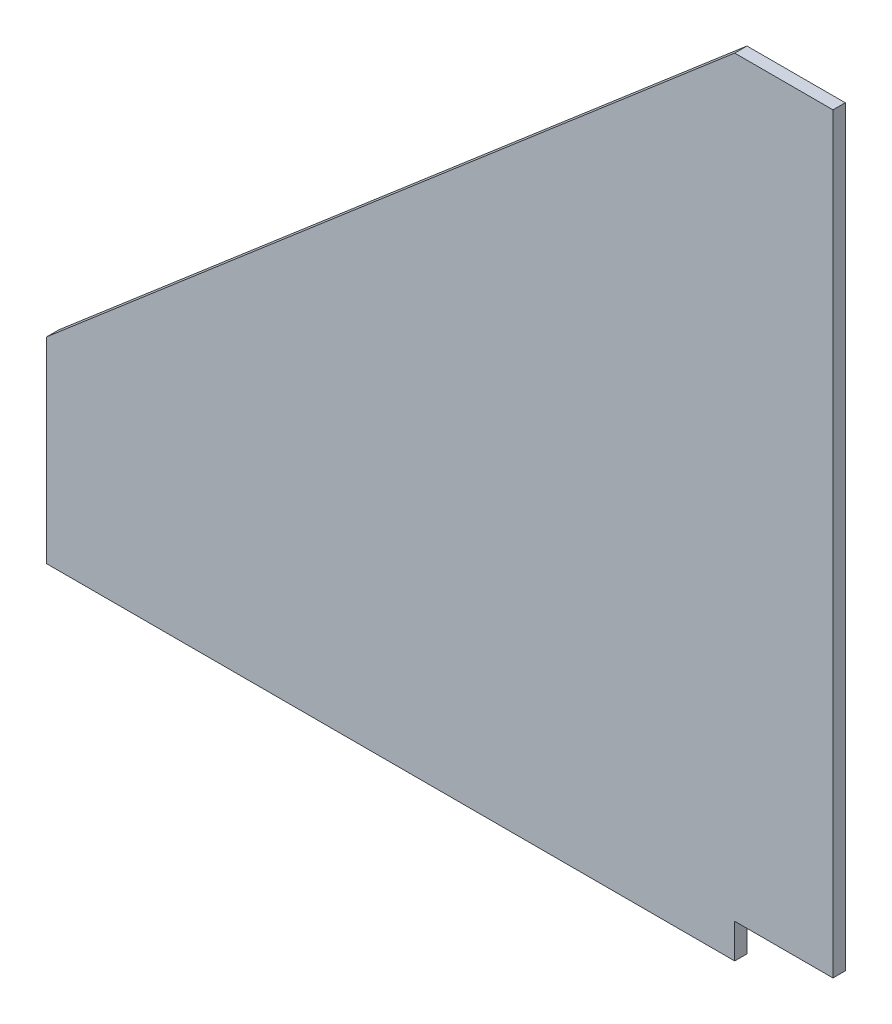
from build123d import *

# Parameters (mm, degrees)
BOSS_EXTRUDE1_DEPTH = 3.175


with BuildPart() as part:
    # Sketch1 → Boss-Extrude1 (new body)
    with BuildSketch(Plane.XY):
        Polygon((0, 0), (0, 194.31), (-25.4, 194.31), (-203.2, 41.91), (-203.2, -8.89), (-25.4, -8.89), (-25.4, 0), align=None)
    extrude(amount=BOSS_EXTRUDE1_DEPTH)


solid = part.part
